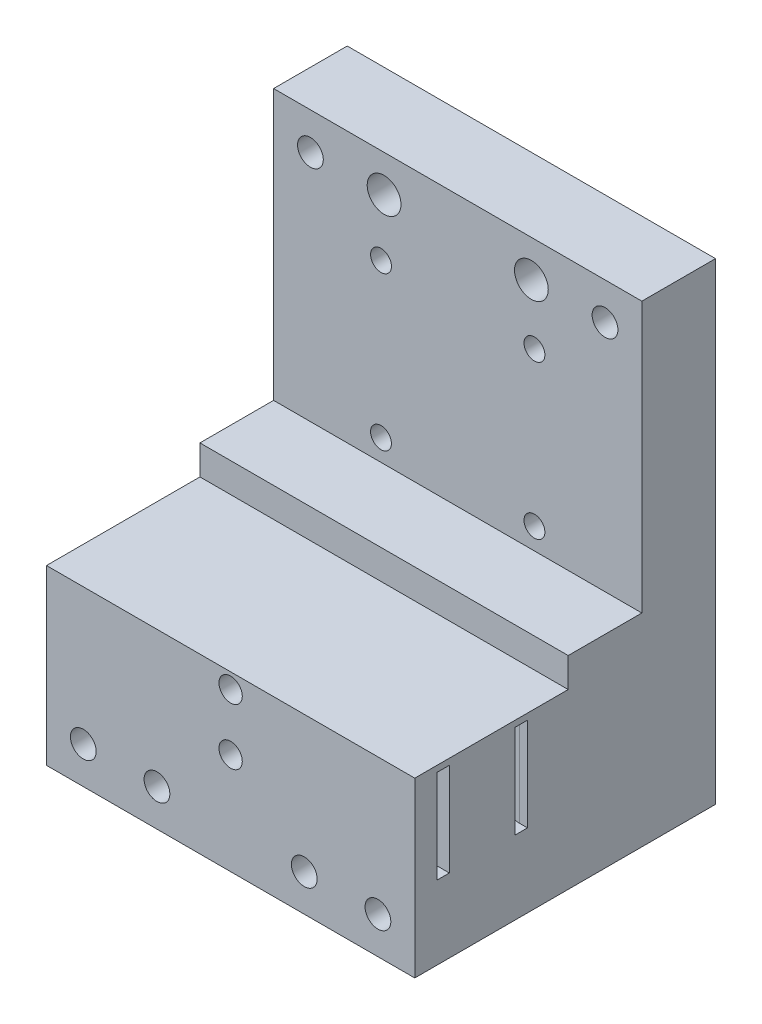
from build123d import *

# Parameters (mm, degrees)
SKETCH1_W                      = 60
SKETCH1_H                      = 53
BOSS_EXTRUDE1_DEPTH            = 12
SKETCH2_W                      = 60
SKETCH2_H                      = 21
BOSS_EXTRUDE2_DEPTH            = 12
SKETCH4_W                      = 40.2
SKETCH4_H                      = 18.2
CUT_EXTRUDE1_DEPTH             = 10
SKETCH5_R                      = 1.9
CUT_EXTRUDE2_DEPTH             = 43.405777908
SKETCH8_W                      = 60
SKETCH8_H                      = 16.2
SKETCH8_R                      = 1.9
BOSS_EXTRUDE3_DEPTH            = 25
CUT_EXTRUDE3_DEPTH             = 15.2
FILLET1_R                      = 5
FILLET2_R                      = 7
BOSS_EXTRUDE5_REACH            = 80.166
CUT_EXTRUDE4_DEPTH             = 69.773832233
MIRROR1_START                  = -26.5
MIRROR1_DEPTH                  = 15.2
MIRROR1_START_2                = -11.3
MIRROR1_2_DEPTH                = 3
SKETCH10_W                     = 60
SKETCH10_H                     = 49
BOSS_EXTRUDE4_DEPTH            = 12
SKETCH16_W                     = 60
SKETCH16_H                     = 12
BOSS_EXTRUDE6_DEPTH            = 12
M5X0_8_TAPPED_HOLE1_D          = 4.2
CBORE_FOR_M3_SHCS1_D           = 3.4
CBORE_FOR_M3_SHCS1_CBORE_D     = 6.5
CBORE_FOR_M3_SHCS1_CBORE_DEPTH = 6
CBORE_FOR_M5_SHCS1_D           = 5.5
CBORE_FOR_M5_SHCS1_CBORE_D     = 10
CBORE_FOR_M5_SHCS1_CBORE_DEPTH = 5


# Read off the part's stored shape, not the designer's step: Mirror1
with BuildPart() as part:
    # Sketch1 → Boss-Extrude1 (new body)
    with BuildSketch(Plane.XY):
        Rectangle(SKETCH1_W, SKETCH1_H)
    extrude(amount=BOSS_EXTRUDE1_DEPTH)

    # Sketch2 → Boss-Extrude2 (add)
    with BuildSketch(Plane(origin=(0, 0, 12), x_dir=(-1, 0, 0), z_dir=(0, 0, -1))):
        with Locations((0, -16)):
            Rectangle(SKETCH2_W, SKETCH2_H)
    extrude(amount=-BOSS_EXTRUDE2_DEPTH)

    # Sketch4 → Cut-Extrude1 (cut)
    with BuildSketch(Plane(origin=(0, 0, 0), x_dir=(-1, 0, 0), z_dir=(0, 0, -1))):
        with Locations((0, -17.4)):
            Rectangle(SKETCH4_W, SKETCH4_H)
    extrude(amount=-CUT_EXTRUDE1_DEPTH, mode=Mode.SUBTRACT)

    # Sketch5 → Cut-Extrude2 (cut, through all)
    with BuildSketch(Plane(origin=(0, 0, 10), x_dir=(-1, 0, 0), z_dir=(0, 0, -1))):
        with Locations((0, -12.8)):
            Circle(SKETCH5_R)
        with Locations((0, -22)):
            Circle(SKETCH5_R)
    extrude(amount=-CUT_EXTRUDE2_DEPTH, mode=Mode.SUBTRACT)

    # Sketch8 → Boss-Extrude3 (add)
    with BuildSketch(Plane.XY.offset(24)):
        with Locations((0, -18.4)):
            Rectangle(SKETCH8_W, SKETCH8_H)
        with Locations(Location((0, -22, 0), (0, 0, 180))):
            Circle(SKETCH8_R, mode=Mode.SUBTRACT)
        with Locations(Location((0, -12.8, 0), (0, 0, 180))):
            Circle(SKETCH8_R, mode=Mode.SUBTRACT)
    extrude(amount=BOSS_EXTRUDE3_DEPTH)

    # Sketch9 → Cut-Extrude3 (cut)
    with BuildSketch(Plane.XZ.offset(26.5)):
        Polygon((20.1, 10), (25.1, 10), (17.051847549, 45.365), (30, 45.365), (30, 43.365), (19.558131605, 43.365), (22, 32.635), (30, 32.635), (30, 30.635), (22.455147884, 30.635), (27.606284055, 8), (20.1, 8), align=None)
    extrude(amount=-CUT_EXTRUDE3_DEPTH, mode=Mode.SUBTRACT)

    # Fillet1
    fillet1_edges = [part.edges().sort_by_distance(p)[0] for p in [
        (19.558131605, -18.9, 43.365),
        (22.455147884, -18.9, 30.635),
        (25.1, -18.9, 10),
    ]]
    fillet(fillet1_edges, radius=FILLET1_R)

    # Fillet2
    # the kernel refuses this fillet: 7 mm, written as the material it adds along each edge
    with BuildSketch(Plane(origin=(27.606284055, -26.5, 8), x_dir=(-1, 0, 0), z_dir=(0, 1, 0))) as fillet2_piece_1:
        with BuildLine():
            CenterArc((8.746780519, 6.889206669), FILLET2_R, 167.179324342, 92.613163385)
            Line((1.921295117, 8.442509286), (1.784785409, 8.473575339))
            Line((1.784785409, 8.473575339), (-0.136509708, 0.031066052))
            Line((-0.136509708, 0.031066052), (0, -0.14))
            ThreePointArc((0, -0.14), (3.753142028, -0.14), (7.481474126, -0.137784133))
            Line((7.481474126, -0.137784133), (7.506284055, 0))
        make_face()
    extrude(amount=15.2)
    with BuildSketch(Plane(origin=(17.051847549, -26.5, 45.365), x_dir=(0.22190037393070375, 0, -0.9750693432004792), z_dir=(0, 1, 0))) as fillet2_piece_2:
        with BuildLine():
            CenterArc((FILLET2_R * 1.25314202775, -FILLET2_R), FILLET2_R, 90, 102.820675658)
            Line((FILLET2_R * 0.278072684545, -FILLET2_R * 1.22190037393), (FILLET2_R * 0.258571297681, -FILLET2_R * 1.22633838141))
            Line((FILLET2_R * 0.258571297681, -FILLET2_R * 1.22633838141), (-FILLET2_R * 0.0250628405549, FILLET2_R * 0.02))
            Line((-FILLET2_R * 0.0250628405549, FILLET2_R * 0.02), (FILLET2_R * 1.25314202775, FILLET2_R * 0.02))
            Line((FILLET2_R * 1.25314202775, FILLET2_R * 0.02), (FILLET2_R * 1.25314202775, 0))
        make_face()
    extrude(amount=15.2)

    # Sketch14 → Boss-Extrude5 (add, up to next)
    with BuildSketch(Plane.XZ.offset(26.5), mode=Mode.PRIVATE) as boss_extrude5_sk1:
        with BuildLine():
            Line((22, 32.635), (22.758425927, 29.30234284))
            ThreePointArc((22.758425927, 29.30234284), (25.30555422, 31.745294587), (28.720858022, 32.635))
            Line((28.720858022, 32.635), (22, 32.635))
        make_face()
    boss_extrude5_tool1 = extrude(boss_extrude5_sk1.sketch, amount=-BOSS_EXTRUDE5_REACH, mode=Mode.PRIVATE) - part.part
    add(boss_extrude5_tool1.solids().sort_by_distance((23.8726, -26.5, 31.664798))[0])

    # Sketch15 → Cut-Extrude4 (cut, through all)
    with BuildSketch(Plane.XZ.offset(11.3)):
        with BuildLine():
            Line((25.684988939, 16.442509286), (23.709636577, 16.10950187))
            ThreePointArc((23.709636577, 16.10950187), (23.108491418, 12.40554417), (20.1, 10.16285437))
            Line((20.1, 10.16285437), (20.1, 0))
            Line((20.1, 0), (25.859503536, 0))
            Line((25.859503536, 0), (25.859503536, 14.889206669))
            ThreePointArc((25.859503536, 14.889206669), (25.815738072, 15.670744314), (25.684988939, 16.442509286))
        make_face()
    extrude(amount=CUT_EXTRUDE4_DEPTH, mode=Mode.SUBTRACT)

    # Mirror1 outline → Mirror1 (cut)
    with BuildSketch(Plane(origin=(0, 0, 0), x_dir=(1, 0, 0), z_dir=(0, 1, 0)).offset(MIRROR1_START)):
        with BuildLine():
            Line((-30, -32.635), (-28.720858022, -32.635))
            ThreePointArc((-28.720858022, -32.635), (-25.30555422, -31.745294587), (-22.758425927, -29.30234284))
            Line((-22.758425927, -29.30234284), (-20.948495028, -37.25549813))
            ThreePointArc((-20.948495028, -37.25549813), (-21.915676615, -41.483692887), (-25.823841744, -43.365))
            Line((-25.823841744, -43.365), (-30, -43.365))
            Line((-30, -43.365), (-30, -45.365))
            Line((-30, -45.365), (-25.823841744, -45.365))
            ThreePointArc((-25.823841744, -45.365), (-20.352410563, -42.731170042), (-18.998356341, -36.811697382))
            Line((-18.998356341, -36.811697382), (-23.709636577, -16.10950187))
            ThreePointArc((-23.709636577, -16.10950187), (-22.74245499, -11.881307113), (-18.834289861, -10))
            Line((-18.834289861, -10), (-20.1, -10))
            Line((-20.1, -10), (-20.1, 0))
            Line((-20.1, 0), (-25.859503536, 0))
            Line((-25.859503536, 0), (-25.859503536, -14.889206669))
            ThreePointArc((-25.859503536, -14.889206669), (-25.815738072, -15.670744314), (-25.684988939, -16.442509286))
            Line((-25.684988939, -16.442509286), (-23.845511306, -24.52549813))
            ThreePointArc((-23.845511306, -24.52549813), (-24.812692893, -28.753692887), (-28.720858022, -30.635))
            Line((-28.720858022, -30.635), (-30, -30.635))
            Line((-30, -30.635), (-30, -32.635))
        make_face()
    extrude(amount=MIRROR1_DEPTH, mode=Mode.SUBTRACT)

    # Mirror1 2 outline → Mirror1 2 (cut)
    with BuildSketch(Plane(origin=(0, 0, 0), x_dir=(1, 0, 0), z_dir=(0, 1, 0)).offset(MIRROR1_START_2)):
        with BuildLine():
            Line((-18.834289861, -10), (-20.1, -10))
            Line((-20.1, -10), (-20.1, -10.16285437))
            ThreePointArc((-20.1, -10.16285437), (-19.472361899, -10.040880716), (-18.834289861, -10))
        make_face()
    extrude(amount=MIRROR1_2_DEPTH, mode=Mode.SUBTRACT)

    # Sketch10 → Boss-Extrude4 (add)
    with BuildSketch(Plane.XZ.offset(26.5)):
        with Locations((0, 24.5)):
            Rectangle(SKETCH10_W, SKETCH10_H)
    extrude(amount=BOSS_EXTRUDE4_DEPTH)

    # Sketch16 → Boss-Extrude6 (add)
    with BuildSketch(Plane.XY.offset(12)):
        with Locations((0, 32.5)):
            Rectangle(SKETCH16_W, SKETCH16_H)
    extrude(amount=-BOSS_EXTRUDE6_DEPTH)

    # M5x0.8 Tapped Hole1 (through all)
    with Locations(Plane(origin=(0, 0, 0), x_dir=(-1, 0, 0), z_dir=(0, 0, -1))):
        with Locations((-24, 32.5), (-24, -32.5), (24, -32.5), (24, 32.5), (-12, -32.5), (12, -32.5)):
            Hole(M5X0_8_TAPPED_HOLE1_D / 2)

    # CBORE for M3 SHCS1 (through all)
    with Locations(Plane(origin=(0, 0, 0), x_dir=(-1, 0, 0), z_dir=(0, 0, -1))):
        with Locations((12.5, -2), (-12.5, -2), (-12.5, 23), (12.5, 23)):
            CounterBoreHole(CBORE_FOR_M3_SHCS1_D / 2, CBORE_FOR_M3_SHCS1_CBORE_D / 2, CBORE_FOR_M3_SHCS1_CBORE_DEPTH)

    # CBORE for M5 SHCS1 (through all)
    with Locations(Plane(origin=(0, 0, 0), x_dir=(-1, 0, 0), z_dir=(0, 0, -1))):
        with Locations((-12, 32.5), (12, 32.5)):
            CounterBoreHole(CBORE_FOR_M5_SHCS1_D / 2, CBORE_FOR_M5_SHCS1_CBORE_D / 2, CBORE_FOR_M5_SHCS1_CBORE_DEPTH)


solid = part.part
